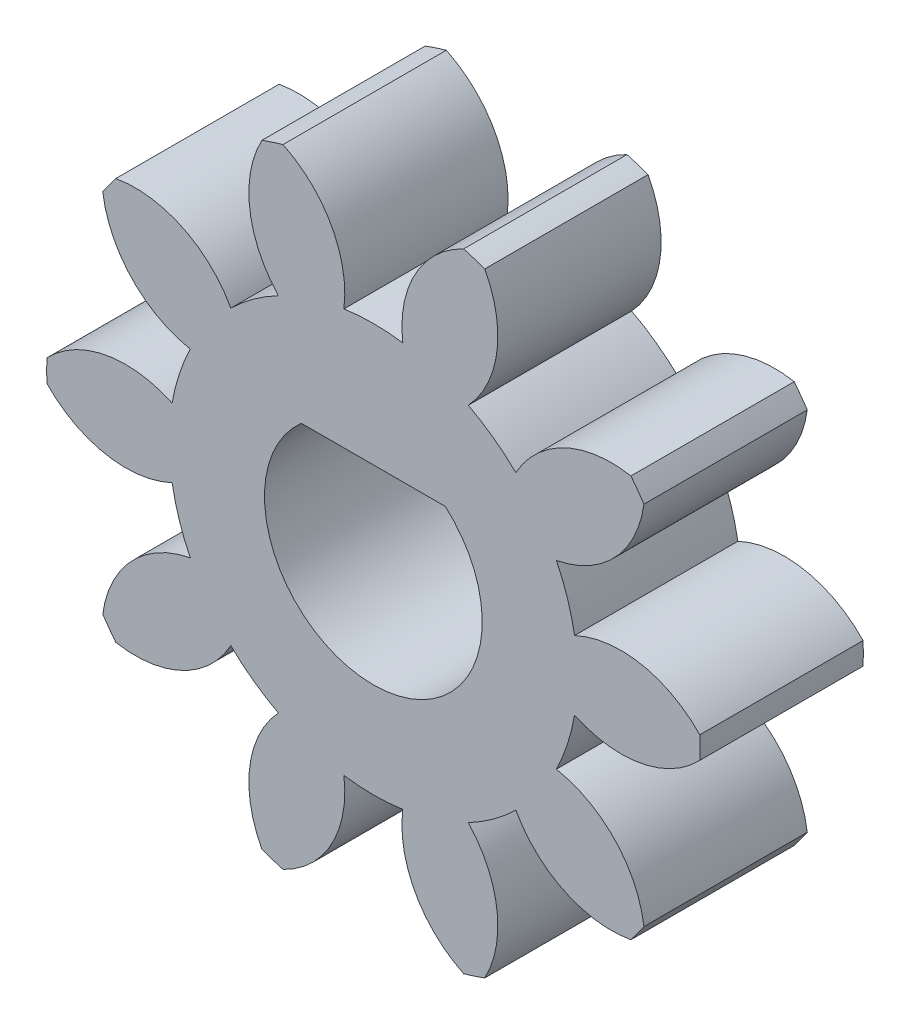
from build123d import *

# Parameters (mm, degrees)
SKETCH1_R           = 6
BOSS_EXTRUDE1_DEPTH = 3
CUT_EXTRUDE1_DEPTH  = 10
CIRPATTERN1_COUNT   = 10
CUT_EXTRUDE3_DEPTH  = 9.845679738


with BuildPart() as part:
    # Sketch1 → Boss-Extrude1 (new body)
    with BuildSketch(Plane.XY):
        Circle(SKETCH1_R)
    extrude(amount=BOSS_EXTRUDE1_DEPTH)

    # Sketch2 → Cut-Extrude1 (cut, through all)
    with BuildSketch(Plane.XY.offset(3)):
        with BuildLine():
            ThreePointArc((-1.659502931, 5.765938781), (-0.768019042, 4.919153149), (-0.540379921, 3.710861024))
            ThreePointArc((-0.540379921, 3.710861024), (0, 3.75), (0.540379921, 3.710861024))
            ThreePointArc((0.540379921, 3.710861024), (0.768019042, 4.919153149), (1.659502931, 5.765938781))
            ThreePointArc((1.659502931, 5.765938781), (0, 6), (-1.659502931, 5.765938781))
        make_face()
    cut_extrude1 = extrude(amount=-CUT_EXTRUDE1_DEPTH, mode=Mode.SUBTRACT)

    # CirPattern1: Cut-Extrude1 ×10 about axis
    cirpattern1_axis = Axis((0, 0, 3), (0, 0, 1))
    for i in range(1, CIRPATTERN1_COUNT):
        add(cut_extrude1.rotate(cirpattern1_axis, i * 360 / CIRPATTERN1_COUNT), mode=Mode.SUBTRACT)

    # Sketch5 → Cut-Extrude3 (cut, through all)
    with BuildSketch(Plane.XY.offset(3)):
        with BuildLine():
            Line((1.322875656, 1.5), (-1.322875656, 1.5))
            ThreePointArc((-1.322875656, 1.5), (0, -2), (1.322875656, 1.5))
        make_face()
    extrude(amount=-CUT_EXTRUDE3_DEPTH, mode=Mode.SUBTRACT)


solid = part.part
